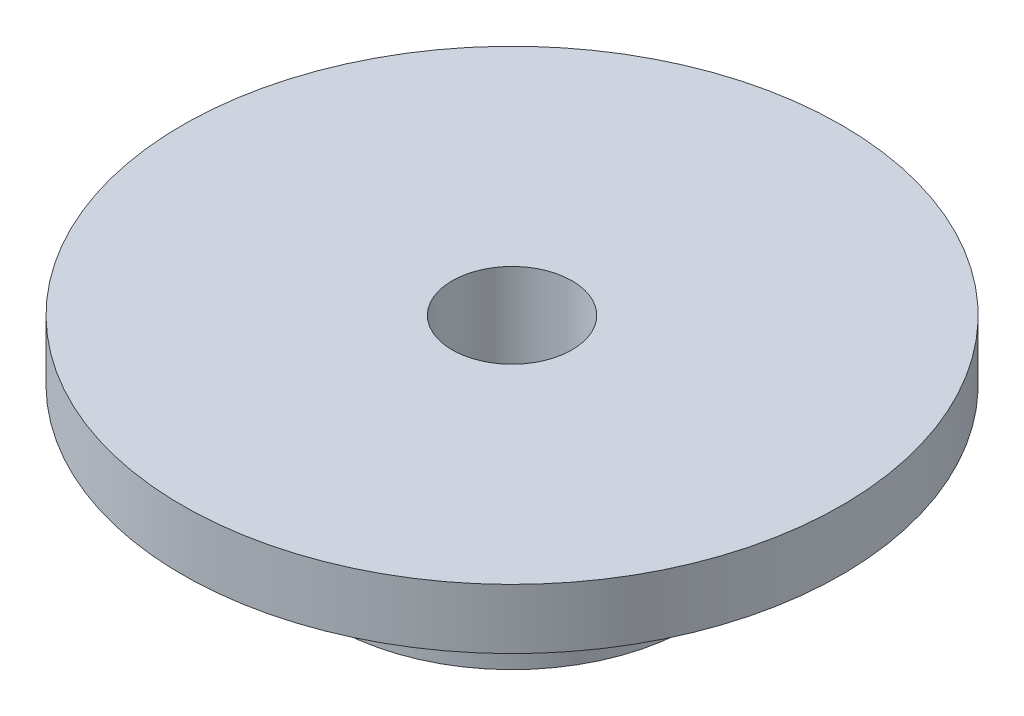
from build123d import *


with BuildPart() as part:
    # Эскиз1 → Повернуть1 (revolve)
    with BuildSketch(Plane.XY):
        Polygon((2, -0.353980743), (2, 5.646019257), (11, 5.646019257), (11, 3.646019257), (6, 3.646019257), (6, -0.353980743), align=None)
    revolve(axis=Axis((0, 0, 0), (0, 1, 0)))


solid = part.part
